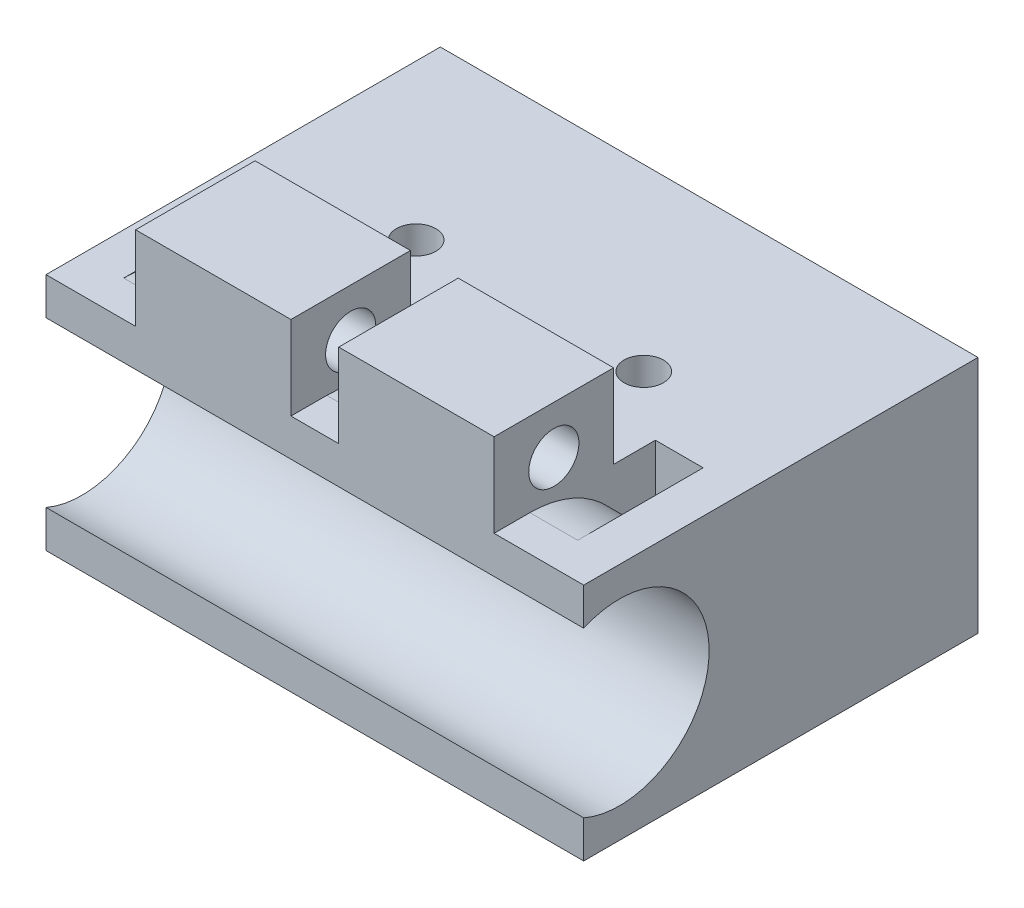
from build123d import *

# Parameters (mm, degrees)
SKETCH2_W             = 45
SKETCH2_H             = 20
BOSS_EXTRUDE1_DEPTH   = 33
SKETCH3_R             = 7.5
CUT_EXTRUDE1_DEPTH    = 45
SKETCH4_R             = 4
CUT_EXTRUDE2_DEPTH    = 10
SKETCH5_W             = 4
SKETCH5_H             = 1.5
CUT_EXTRUDE3_DEPTH    = 39
FILLET1_R             = 9
M4X0_7_TAPPED_HOLE1_D = 3.3
SKETCH8_W             = 13
SKETCH8_H             = 10
BOSS_EXTRUDE2_DEPTH   = 7
SKETCH14_R            = 2.1
CUT_EXTRUDE6_DEPTH    = 53.765992836
BODY_MOVE_COPY1_ANGLE = 180


with BuildPart() as part:
    # Sketch2 → Boss-Extrude1 (new body)
    with BuildSketch(Plane.XY):
        Rectangle(SKETCH2_W, SKETCH2_H)
    extrude(amount=BOSS_EXTRUDE1_DEPTH)

    # Sketch3 → Cut-Extrude1 (cut)
    with BuildSketch(Plane(origin=(22.5, 0, 0), x_dir=(0, 0, -1), z_dir=(1, 0, 0))):
        with Locations((-30, 0)):
            Circle(SKETCH3_R)
    extrude(amount=-CUT_EXTRUDE1_DEPTH, mode=Mode.SUBTRACT)

    # Sketch4 → Cut-Extrude2 (cut)
    with BuildSketch(Plane(origin=(0, 0, 0), x_dir=(-1, 0, 0), z_dir=(0, 0, -1))):
        with Locations((-15, 0)):
            Circle(SKETCH4_R)
        with Locations((15, 0)):
            Circle(SKETCH4_R)
    extrude(amount=-CUT_EXTRUDE2_DEPTH, mode=Mode.SUBTRACT)

    # Sketch5 → Cut-Extrude3 (cut)
    with BuildSketch(Plane.XZ.offset(10)):
        with Locations((-17, 20.25)):
            Rectangle(SKETCH5_W, SKETCH5_H)
        with Locations((0, 20.25)):
            Rectangle(SKETCH5_W, SKETCH5_H)
        with Locations((17, 20.25)):
            Rectangle(SKETCH5_W, SKETCH5_H)
    extrude(amount=-CUT_EXTRUDE3_DEPTH, mode=Mode.SUBTRACT)

    # Fillet1
    fillet1_edges = [part.edges().sort_by_distance(p)[0] for p in [
        (17, -10, 21),
        (0, -10, 21),
        (-17, -10, 21),
    ]]
    fillet(fillet1_edges, radius=FILLET1_R)

    # M4x0.7 Tapped Hole1 (through all)
    with Locations(Plane(origin=(0, -10, 0), x_dir=(-1, 0, 0), z_dir=(0, -1, 0))):
        with Locations((-9.525, -15), (9.525, -15)):
            Hole(M4X0_7_TAPPED_HOLE1_D / 2)

    # Sketch8 → Boss-Extrude2 (add)
    with BuildSketch(Plane.XZ.offset(10)):
        with Locations((-8.5, 28)):
            Rectangle(SKETCH8_W, SKETCH8_H)
        with Locations((8.5, 28)):
            Rectangle(SKETCH8_W, SKETCH8_H)
    extrude(amount=BOSS_EXTRUDE2_DEPTH)

    # Sketch14 → Cut-Extrude6 (cut, through all)
    with BuildSketch(Plane.ZY.offset(15)):
        with Locations((28, -13)):
            Circle(SKETCH14_R)
    extrude(amount=-CUT_EXTRUDE6_DEPTH, mode=Mode.SUBTRACT)


with BuildPart() as part_1:
    # Body-Move/Copy1: moved
    add(part.part.rotate(Axis((0, -3.5, 0), (0, 0, 1)), BODY_MOVE_COPY1_ANGLE))


solid = part_1.part
